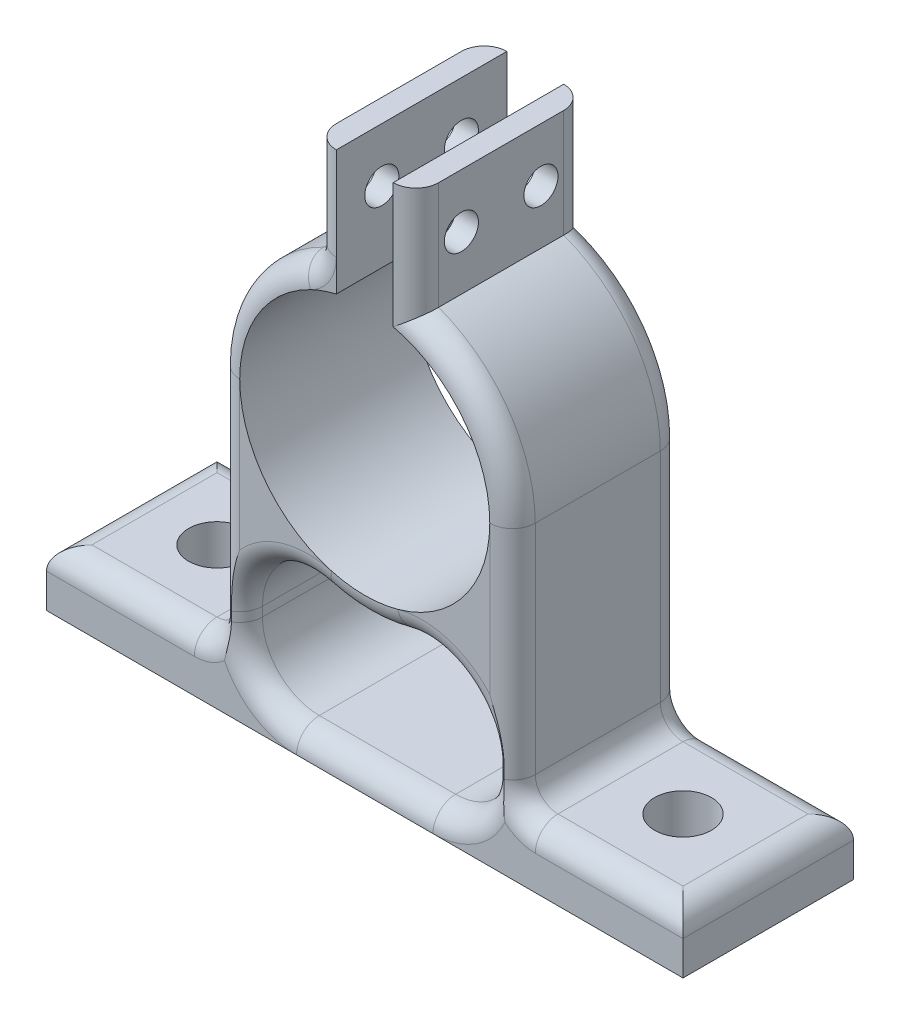
from build123d import *

# Parameters (mm, degrees)
EXTRUDE_1_DEPTH     = 15
SKETCH_2_W          = 15
SKETCH_2_H          = 15
SKETCH_2_R          = 2.5
EXTRUDE_2_DEPTH     = 5
FILLET_2_R          = 6
FILLET_1_R          = 5
FILLET_9_R          = 2
FILLET_10_R         = 2
FILLET_11_R         = 2
FILLET_12_R         = 2
SKETCH_2_3_R        = 2.5
CUT_EXTRUDE_1_DEPTH = 5
SKETCH_3_R          = 1.5
CUT_EXTRUDE_2_DEPTH = 45.329139442


# Read off the part's stored shape, not the designer's step: 보스-돌출1
with BuildPart() as part:
    # 보스-돌출1 outline → 보스-돌출1 (new body)
    with BuildSketch(Plane.XY):
        with BuildLine():
            Line((2.5, 21.696310918), (2.5, 10.712142643))
            ThreePointArc((2.5, 10.712142643), (0, -11), (-2.5, 10.712142643))
            Line((-2.5, 10.712142643), (-2.5, 21.696310918))
            Line((-2.5, 21.696310918), (-4.5, 21.696310918))
            Line((-4.5, 21.696310918), (-4.5, 12.196310918))
            ThreePointArc((-4.5, 12.196310918), (-10.665363983, 7.433035122), (-13, 1.824e-06))
            Line((-13, 1.824e-06), (-13, -26.150001824))
            Line((-13, -26.150001824), (13, -26.150001824))
            Line((13, -26.150001824), (13, -1.824e-06))
            ThreePointArc((13, -1.824e-06), (10.665365025, 7.433033626), (4.5, 12.196310918))
            Line((4.5, 12.196310918), (4.5, 21.696310918))
            Line((4.5, 21.696310918), (2.5, 21.696310918))
        make_face()
        with BuildLine():
            Line((11, -24.150001824), (-11, -24.150001824))
            Line((-11, -24.150001824), (-11, -6.92820323))
            ThreePointArc((-11, -6.92820323), (0, -13), (11, -6.92820323))
            Line((11, -6.92820323), (11, -24.150001824))
        make_face(mode=Mode.SUBTRACT)
    extrude(amount=EXTRUDE_1_DEPTH)

    # 스케치2 → 보스-돌출2 (add)
    # profile 1 of 4: a face of its own
    with BuildSketch(Plane.XZ.offset(26.150001824)):
        with Locations((-20.5, 7.5)):
            Rectangle(SKETCH_2_W, SKETCH_2_H)
        with Locations((-20.5, 7.5)):
            Circle(SKETCH_2_R, mode=Mode.SUBTRACT)
    # profile 2 of 4: a face of its own
    with BuildSketch(Plane.XZ.offset(26.150001824)):
        with Locations((20.5, 7.5)):
            Rectangle(SKETCH_2_W, SKETCH_2_H)
        with Locations((20.5, 7.5)):
            Circle(SKETCH_2_R, mode=Mode.SUBTRACT)
    # profile 3 of 4: a face of its own
    with BuildSketch(Plane.XZ.offset(26.150001824)):
        with Locations((20.5, 7.5)):
            Circle(SKETCH_2_R)
    # profile 4 of 4: a face of its own
    with BuildSketch(Plane.XZ.offset(26.150001824)):
        with Locations((-20.5, 7.5)):
            Circle(SKETCH_2_R)
    extrude(amount=-EXTRUDE_2_DEPTH)

    # 필렛2
    fillet_2_edges = [part.edges().sort_by_distance(p)[0] for p in [
        (11, -6.92820323, 7.5),
        (-11, -6.92820323, 7.5),
    ]]
    fillet(fillet_2_edges, radius=FILLET_2_R)

    # 필렛1
    fillet_1_edges = [part.edges().sort_by_distance(p)[0] for p in [
        (-11, -24.150001824, 7.5),
        (11, -24.150001824, 7.5),
    ]]
    fillet(fillet_1_edges, radius=FILLET_1_R)

    # 필렛9
    fillet_9_edges = [part.edges().sort_by_distance(p)[0] for p in [
        (-4.5, 12.196310918, 7.5),
    ]]
    fillet(fillet_9_edges, radius=FILLET_9_R)

    # 필렛10
    fillet_10_edges = [part.edges().sort_by_distance(p)[0] for p in [
        (-13, -21.150001824, 7.5),
    ]]
    fillet(fillet_10_edges, radius=FILLET_10_R)

    # 필렛11
    fillet_11_edges = [part.edges().sort_by_distance(p)[0] for p in [
        (13, -21.150001824, 7.5),
    ]]
    fillet(fillet_11_edges, radius=FILLET_11_R)

    # 필렛12
    # the kernel refuses this fillet: 2 mm, written as the material it takes off along each edge
    with BuildSketch(Plane(origin=(-6, -19.150001824, 15), x_dir=(-1, 0, 0), z_dir=(0, 1, 0))) as fillet_12_piece_1:
        with BuildLine():
            CenterArc((5 + FILLET_12_R, -FILLET_12_R), FILLET_12_R, 90, 90)
            Line((5 + FILLET_12_R, 0), (5 + FILLET_12_R, FILLET_12_R * 0.02))
            Line((5 + FILLET_12_R, FILLET_12_R * 0.02), (5 - FILLET_12_R * 0.02, FILLET_12_R * 0.02))
            Line((5 - FILLET_12_R * 0.02, FILLET_12_R * 0.02), (5 - FILLET_12_R * 0.02, -FILLET_12_R))
            Line((5 - FILLET_12_R * 0.02, -FILLET_12_R), (5, -FILLET_12_R))
        make_face()
    revolve(axis=Axis((-6, -19.150001824, 15), (0, 0, 1)), revolution_arc=90, mode=Mode.SUBTRACT)
    with BuildSketch(Plane(origin=(6, -19.150001824, 0), x_dir=(1, 0, 0), z_dir=(0, 1, 0))) as fillet_12_piece_2:
        with BuildLine():
            CenterArc((5 + FILLET_12_R, -FILLET_12_R), FILLET_12_R, 90, 90)
            Line((5, -FILLET_12_R), (5 - FILLET_12_R * 0.02, -FILLET_12_R))
            Line((5 - FILLET_12_R * 0.02, -FILLET_12_R), (5 - FILLET_12_R * 0.02, FILLET_12_R * 0.02))
            Line((5 - FILLET_12_R * 0.02, FILLET_12_R * 0.02), (5 + FILLET_12_R, FILLET_12_R * 0.02))
            Line((5 + FILLET_12_R, FILLET_12_R * 0.02), (5 + FILLET_12_R, 0))
        make_face()
    revolve(axis=Axis((6, -19.150001824, 0), (0, 0, -1)), revolution_arc=90, mode=Mode.SUBTRACT)
    with BuildSketch(Plane(origin=(-15, -21.150001824, 15), x_dir=(0, 0, -1), z_dir=(-1, 0, 0)), Plane(origin=(28, -21.150001824, 15), x_dir=(0, 0, -1), z_dir=(-1, 0, 0))) as fillet_12_piece_3:
        with BuildLine():
            CenterArc((FILLET_12_R, FILLET_12_R), FILLET_12_R, 180, 90)
            Line((0, FILLET_12_R), (-FILLET_12_R * 0.02, FILLET_12_R))
            Line((-FILLET_12_R * 0.02, FILLET_12_R), (-FILLET_12_R * 0.02, -FILLET_12_R * 0.02))
            Line((-FILLET_12_R * 0.02, -FILLET_12_R * 0.02), (FILLET_12_R, -FILLET_12_R * 0.02))
            Line((FILLET_12_R, -FILLET_12_R * 0.02), (FILLET_12_R, 0))
        make_face()
    extrude(amount=13, mode=Mode.SUBTRACT)
    with BuildSketch(Plane(origin=(-15, -19.150001824, 15), x_dir=(1, 0, 0), z_dir=(0, 1, 0))) as fillet_12_piece_4:
        with BuildLine():
            CenterArc((2 + FILLET_12_R, FILLET_12_R), FILLET_12_R, 180, 90)
            Line((2 + FILLET_12_R, 0), (2 + FILLET_12_R, -FILLET_12_R * 0.02))
            Line((2 + FILLET_12_R, -FILLET_12_R * 0.02), (2 - FILLET_12_R * 0.02, -FILLET_12_R * 0.02))
            Line((2 - FILLET_12_R * 0.02, -FILLET_12_R * 0.02), (2 - FILLET_12_R * 0.02, FILLET_12_R))
            Line((2 - FILLET_12_R * 0.02, FILLET_12_R), (2, FILLET_12_R))
        make_face()
    revolve(axis=Axis((-15, -19.150001824, 15), (0, 0, -1)), revolution_arc=90, mode=Mode.SUBTRACT)
    with BuildSketch(Plane(origin=(15, -21.150001824, 0), x_dir=(0, -1, 0), z_dir=(1, 0, 0)), Plane(origin=(-28, -21.150001824, 0), x_dir=(0, -1, 0), z_dir=(1, 0, 0))) as fillet_12_piece_5:
        with BuildLine():
            CenterArc((FILLET_12_R, -FILLET_12_R), FILLET_12_R, 90, 90)
            Line((0, -FILLET_12_R), (-FILLET_12_R * 0.02, -FILLET_12_R))
            Line((-FILLET_12_R * 0.02, -FILLET_12_R), (-FILLET_12_R * 0.02, FILLET_12_R * 0.02))
            Line((-FILLET_12_R * 0.02, FILLET_12_R * 0.02), (FILLET_12_R, FILLET_12_R * 0.02))
            Line((FILLET_12_R, FILLET_12_R * 0.02), (FILLET_12_R, 0))
        make_face()
    extrude(amount=13, mode=Mode.SUBTRACT)
    with BuildSketch(Plane(origin=(15, -19.150001824, 0), x_dir=(0, -1, 0), z_dir=(1, 0, 0))) as fillet_12_piece_6:
        with BuildLine():
            CenterArc((2 + FILLET_12_R, -FILLET_12_R), FILLET_12_R, 90, 90)
            Line((2, -FILLET_12_R), (2 - FILLET_12_R * 0.02, -FILLET_12_R))
            Line((2 - FILLET_12_R * 0.02, -FILLET_12_R), (2 - FILLET_12_R * 0.02, FILLET_12_R * 0.02))
            Line((2 - FILLET_12_R * 0.02, FILLET_12_R * 0.02), (2 + FILLET_12_R, FILLET_12_R * 0.02))
            Line((2 + FILLET_12_R, FILLET_12_R * 0.02), (2 + FILLET_12_R, 0))
        make_face()
    revolve(axis=Axis((15, -19.150001824, 0), (0, 0, -1)), revolution_arc=90, mode=Mode.SUBTRACT)
    with BuildSketch(Plane(origin=(28, -21.150001824, 0), x_dir=(-1, 0, 0), z_dir=(0, 0, 1))) as fillet_12_piece_7:
        with BuildLine():
            CenterArc((FILLET_12_R, FILLET_12_R), FILLET_12_R, 180, 90)
            Line((0, FILLET_12_R), (-FILLET_12_R * 0.02, FILLET_12_R))
            Line((-FILLET_12_R * 0.02, FILLET_12_R), (-FILLET_12_R * 0.02, -FILLET_12_R * 0.02))
            Line((-FILLET_12_R * 0.02, -FILLET_12_R * 0.02), (FILLET_12_R, -FILLET_12_R * 0.02))
            Line((FILLET_12_R, -FILLET_12_R * 0.02), (FILLET_12_R, 0))
        make_face()
    extrude(amount=15, mode=Mode.SUBTRACT)
    with BuildSketch(Plane(origin=(-28, -21.150001824, 15), x_dir=(0, -1, 0), z_dir=(0, 0, -1))) as fillet_12_piece_8:
        with BuildLine():
            CenterArc((FILLET_12_R, -FILLET_12_R), FILLET_12_R, 90, 90)
            Line((0, -FILLET_12_R), (-FILLET_12_R * 0.02, -FILLET_12_R))
            Line((-FILLET_12_R * 0.02, -FILLET_12_R), (-FILLET_12_R * 0.02, FILLET_12_R * 0.02))
            Line((-FILLET_12_R * 0.02, FILLET_12_R * 0.02), (FILLET_12_R, FILLET_12_R * 0.02))
            Line((FILLET_12_R, FILLET_12_R * 0.02), (FILLET_12_R, 0))
        make_face()
    extrude(amount=15, mode=Mode.SUBTRACT)
    with BuildSketch(Plane(origin=(6, -24.150001824, 0), x_dir=(0, -1, 0), z_dir=(-1, 0, 0)), Plane(origin=(6, -24.150001824, 15), x_dir=(0, 0, -1), z_dir=(-1, 0, 0))) as fillet_12_piece_9:
        with BuildLine():
            CenterArc((FILLET_12_R, FILLET_12_R), FILLET_12_R, 180, 90)
            Line((0, FILLET_12_R), (-FILLET_12_R * 0.02, FILLET_12_R))
            Line((-FILLET_12_R * 0.02, FILLET_12_R), (-FILLET_12_R * 0.02, -FILLET_12_R * 0.02))
            Line((-FILLET_12_R * 0.02, -FILLET_12_R * 0.02), (FILLET_12_R, -FILLET_12_R * 0.02))
            Line((FILLET_12_R, -FILLET_12_R * 0.02), (FILLET_12_R, 0))
        make_face()
    extrude(amount=12, mode=Mode.SUBTRACT)
    with BuildSketch(Plane(origin=(-6, -19.150001824, 0), x_dir=(-1, 0, 0), z_dir=(0, 1, 0))) as fillet_12_piece_10:
        with BuildLine():
            CenterArc((5 + FILLET_12_R, FILLET_12_R), FILLET_12_R, 180, 90)
            Line((5, FILLET_12_R), (5 - FILLET_12_R * 0.02, FILLET_12_R))
            Line((5 - FILLET_12_R * 0.02, FILLET_12_R), (5 - FILLET_12_R * 0.02, -FILLET_12_R * 0.02))
            Line((5 - FILLET_12_R * 0.02, -FILLET_12_R * 0.02), (5 + FILLET_12_R, -FILLET_12_R * 0.02))
            Line((5 + FILLET_12_R, -FILLET_12_R * 0.02), (5 + FILLET_12_R, 0))
        make_face()
    revolve(axis=Axis((-6, -19.150001824, 0), (0, 0, 1)), revolution_arc=90, mode=Mode.SUBTRACT)
    with BuildSketch(Plane(origin=(6, -19.150001824, 15), x_dir=(1, 0, 0), z_dir=(0, 1, 0))) as fillet_12_piece_11:
        with BuildLine():
            CenterArc((5 + FILLET_12_R, FILLET_12_R), FILLET_12_R, 180, 90)
            Line((5 + FILLET_12_R, 0), (5 + FILLET_12_R, -FILLET_12_R * 0.02))
            Line((5 + FILLET_12_R, -FILLET_12_R * 0.02), (5 - FILLET_12_R * 0.02, -FILLET_12_R * 0.02))
            Line((5 - FILLET_12_R * 0.02, -FILLET_12_R * 0.02), (5 - FILLET_12_R * 0.02, FILLET_12_R))
            Line((5 - FILLET_12_R * 0.02, FILLET_12_R), (5, FILLET_12_R))
        make_face()
    revolve(axis=Axis((6, -19.150001824, 15), (0, 0, -1)), revolution_arc=90, mode=Mode.SUBTRACT)
    with BuildSketch(Plane(origin=(-2e-09, 2e-09, 0), x_dir=(-0.4333333332698616, 0.9012337223369036, 0), z_dir=(0.9012337223369036, 0.4333333332698616, 0))) as fillet_12_piece_12:
        with BuildLine():
            CenterArc((12.999999998 - FILLET_12_R, FILLET_12_R), FILLET_12_R, 270, 90)
            Line((12.999999998, FILLET_12_R), (12.999999998 + FILLET_12_R * 0.02, FILLET_12_R))
            Line((12.999999998 + FILLET_12_R * 0.02, FILLET_12_R), (12.999999998 + FILLET_12_R * 0.02, -FILLET_12_R * 0.02))
            Line((12.999999998 + FILLET_12_R * 0.02, -FILLET_12_R * 0.02), (12.999999998 - FILLET_12_R, -FILLET_12_R * 0.02))
            Line((12.999999998 - FILLET_12_R, -FILLET_12_R * 0.02), (12.999999998 - FILLET_12_R, 0))
        make_face()
    revolve(axis=Axis((-2e-09, 2e-09, 0), (0, 0, 1)), revolution_arc=64.320703352, mode=Mode.SUBTRACT)
    with BuildSketch(Plane(origin=(-2e-09, 2e-09, 15), x_dir=(-0.4333333332698616, 0.9012337223369036, 0), z_dir=(0.9012337223369036, 0.4333333332698616, 0))) as fillet_12_piece_13:
        with BuildLine():
            CenterArc((12.999999998 - FILLET_12_R, -FILLET_12_R), FILLET_12_R, 0, 90)
            Line((12.999999998 - FILLET_12_R, 0), (12.999999998 - FILLET_12_R, FILLET_12_R * 0.02))
            Line((12.999999998 - FILLET_12_R, FILLET_12_R * 0.02), (12.999999998 + FILLET_12_R * 0.02, FILLET_12_R * 0.02))
            Line((12.999999998 + FILLET_12_R * 0.02, FILLET_12_R * 0.02), (12.999999998 + FILLET_12_R * 0.02, -FILLET_12_R))
            Line((12.999999998 + FILLET_12_R * 0.02, -FILLET_12_R), (12.999999998, -FILLET_12_R))
        make_face()
    revolve(axis=Axis((-2e-09, 2e-09, 15), (0, 0, 1)), revolution_arc=64.320703352, mode=Mode.SUBTRACT)
    with BuildSketch(Plane(origin=(-4.5, 21.696310918, 0), x_dir=(1, 0, 0), z_dir=(0, -1, 0)), Plane(origin=(-4.5, 21.696310918, 15), x_dir=(0, 0, -1), z_dir=(0, -1, 0))) as fillet_12_piece_14:
        with BuildLine():
            CenterArc((FILLET_12_R, FILLET_12_R), FILLET_12_R, 180, 90)
            Line((0, FILLET_12_R), (-FILLET_12_R * 0.02, FILLET_12_R))
            Line((-FILLET_12_R * 0.02, FILLET_12_R), (-FILLET_12_R * 0.02, -FILLET_12_R * 0.02))
            Line((-FILLET_12_R * 0.02, -FILLET_12_R * 0.02), (FILLET_12_R, -FILLET_12_R * 0.02))
            Line((FILLET_12_R, -FILLET_12_R * 0.02), (FILLET_12_R, 0))
        make_face()
    extrude(amount=8.177805083, mode=Mode.SUBTRACT)
    with BuildSketch(Plane(origin=(-6.5, 13.518505835, 0), x_dir=(1, 0, 0), z_dir=(0, 1, 0))) as fillet_12_piece_15:
        with BuildLine():
            CenterArc((2 + FILLET_12_R, -FILLET_12_R), FILLET_12_R, 90, 90)
            Line((2, -FILLET_12_R), (2 - FILLET_12_R * 0.02, -FILLET_12_R))
            Line((2 - FILLET_12_R * 0.02, -FILLET_12_R), (2 - FILLET_12_R * 0.02, FILLET_12_R * 0.02))
            Line((2 - FILLET_12_R * 0.02, FILLET_12_R * 0.02), (2 + FILLET_12_R, FILLET_12_R * 0.02))
            Line((2 + FILLET_12_R, FILLET_12_R * 0.02), (2 + FILLET_12_R, 0))
        make_face()
    revolve(axis=Axis((-6.5, 13.518505835, 0), (0, 0, -1)), revolution_arc=64.320711385, mode=Mode.SUBTRACT)
    with BuildSketch(Plane(origin=(-6.5, 13.518505835, 15), x_dir=(1, 0, 0), z_dir=(0, 1, 0))) as fillet_12_piece_16:
        with BuildLine():
            CenterArc((2 + FILLET_12_R, FILLET_12_R), FILLET_12_R, 180, 90)
            Line((2 + FILLET_12_R, 0), (2 + FILLET_12_R, -FILLET_12_R * 0.02))
            Line((2 + FILLET_12_R, -FILLET_12_R * 0.02), (2 - FILLET_12_R * 0.02, -FILLET_12_R * 0.02))
            Line((2 - FILLET_12_R * 0.02, -FILLET_12_R * 0.02), (2 - FILLET_12_R * 0.02, FILLET_12_R))
            Line((2 - FILLET_12_R * 0.02, FILLET_12_R), (2, FILLET_12_R))
        make_face()
    revolve(axis=Axis((-6.5, 13.518505835, 15), (0, 0, -1)), revolution_arc=64.320711385, mode=Mode.SUBTRACT)
    with BuildSketch(Plane(origin=(-13, 1.824e-06, 15), x_dir=(0, 0, -1), z_dir=(0, -1, 0)), Plane(origin=(-13, 1.824e-06, 0), x_dir=(1, 0, 0), z_dir=(0, -1, 0))) as fillet_12_piece_17:
        with BuildLine():
            CenterArc((FILLET_12_R, FILLET_12_R), FILLET_12_R, 180, 90)
            Line((0, FILLET_12_R), (-FILLET_12_R * 0.02, FILLET_12_R))
            Line((-FILLET_12_R * 0.02, FILLET_12_R), (-FILLET_12_R * 0.02, -FILLET_12_R * 0.02))
            Line((-FILLET_12_R * 0.02, -FILLET_12_R * 0.02), (FILLET_12_R, -FILLET_12_R * 0.02))
            Line((FILLET_12_R, -FILLET_12_R * 0.02), (FILLET_12_R, 0))
        make_face()
    extrude(amount=19.150003648, mode=Mode.SUBTRACT)
    with BuildSketch(Plane(origin=(-15, -19.150001824, 0), x_dir=(1, 0, 0), z_dir=(0, 1, 0))) as fillet_12_piece_18:
        with BuildLine():
            CenterArc((2 + FILLET_12_R, -FILLET_12_R), FILLET_12_R, 90, 90)
            Line((2, -FILLET_12_R), (2 - FILLET_12_R * 0.02, -FILLET_12_R))
            Line((2 - FILLET_12_R * 0.02, -FILLET_12_R), (2 - FILLET_12_R * 0.02, FILLET_12_R * 0.02))
            Line((2 - FILLET_12_R * 0.02, FILLET_12_R * 0.02), (2 + FILLET_12_R, FILLET_12_R * 0.02))
            Line((2 + FILLET_12_R, FILLET_12_R * 0.02), (2 + FILLET_12_R, 0))
        make_face()
    revolve(axis=Axis((-15, -19.150001824, 0), (0, 0, -1)), revolution_arc=90, mode=Mode.SUBTRACT)
    with BuildSketch(Plane(origin=(13, -19.150001824, 0), x_dir=(-1, 0, 0), z_dir=(0, 1, 0)), Plane(origin=(13, -19.150001824, 15), x_dir=(0, 0, -1), z_dir=(0, 1, 0))) as fillet_12_piece_19:
        with BuildLine():
            CenterArc((FILLET_12_R, FILLET_12_R), FILLET_12_R, 180, 90)
            Line((0, FILLET_12_R), (-FILLET_12_R * 0.02, FILLET_12_R))
            Line((-FILLET_12_R * 0.02, FILLET_12_R), (-FILLET_12_R * 0.02, -FILLET_12_R * 0.02))
            Line((-FILLET_12_R * 0.02, -FILLET_12_R * 0.02), (FILLET_12_R, -FILLET_12_R * 0.02))
            Line((FILLET_12_R, -FILLET_12_R * 0.02), (FILLET_12_R, 0))
        make_face()
    extrude(amount=19.15, mode=Mode.SUBTRACT)
    with BuildSketch(Plane(origin=(15, -19.150001824, 15), x_dir=(0, -1, 0), z_dir=(1, 0, 0))) as fillet_12_piece_20:
        with BuildLine():
            CenterArc((2 + FILLET_12_R, FILLET_12_R), FILLET_12_R, 180, 90)
            Line((2 + FILLET_12_R, 0), (2 + FILLET_12_R, -FILLET_12_R * 0.02))
            Line((2 + FILLET_12_R, -FILLET_12_R * 0.02), (2 - FILLET_12_R * 0.02, -FILLET_12_R * 0.02))
            Line((2 - FILLET_12_R * 0.02, -FILLET_12_R * 0.02), (2 - FILLET_12_R * 0.02, FILLET_12_R))
            Line((2 - FILLET_12_R * 0.02, FILLET_12_R), (2, FILLET_12_R))
        make_face()
    revolve(axis=Axis((15, -19.150001824, 15), (0, 0, -1)), revolution_arc=90, mode=Mode.SUBTRACT)
    with BuildSketch(Plane(origin=(4.5, 7.196310918, 0), x_dir=(-1, 0, 0), z_dir=(0, 1, 0))) as fillet_12_piece_21_section:
        with BuildLine():
            CenterArc((FILLET_12_R, FILLET_12_R), FILLET_12_R, 180, 90)
            Line((0, FILLET_12_R), (-FILLET_12_R * 0.02, FILLET_12_R))
            Line((-FILLET_12_R * 0.02, FILLET_12_R), (-FILLET_12_R * 0.02, -FILLET_12_R * 0.02))
            Line((-FILLET_12_R * 0.02, -FILLET_12_R * 0.02), (FILLET_12_R, -FILLET_12_R * 0.02))
            Line((FILLET_12_R, -FILLET_12_R * 0.02), (FILLET_12_R, 0))
        make_face()
    fillet_12_piece_21 = extrude(amount=14.5, mode=Mode.PRIVATE)
    fillet_12_piece_21 = fillet_12_piece_21 - Plane(origin=(-1e-09, 0, 0.456502174), x_dir=(0.9999999999999902, -1.4030200042681218e-07, 0), z_dir=(0, 0, -1)) * Cylinder(13.000000001, 37, mode=Mode.PRIVATE)
    add(fillet_12_piece_21, mode=Mode.SUBTRACT)
    with BuildSketch(Plane(origin=(-1e-09, 0, 0), x_dir=(0.9999999999999901, -1.4030200042681218e-07, 0), z_dir=(-1.4030200042681218e-07, -0.9999999999999901, 0))) as fillet_12_piece_22_section:
        with BuildLine():
            CenterArc((13.000000001 - FILLET_12_R, FILLET_12_R), FILLET_12_R, 270, 90)
            Line((13.000000001, FILLET_12_R), (13.000000001 + FILLET_12_R * 0.02, FILLET_12_R))
            Line((13.000000001 + FILLET_12_R * 0.02, FILLET_12_R), (13.000000001 + FILLET_12_R * 0.02, -FILLET_12_R * 0.02))
            Line((13.000000001 + FILLET_12_R * 0.02, -FILLET_12_R * 0.02), (13.000000001 - FILLET_12_R, -FILLET_12_R * 0.02))
            Line((13.000000001 - FILLET_12_R, -FILLET_12_R * 0.02), (13.000000001 - FILLET_12_R, 0))
        make_face()
    fillet_12_piece_22 = revolve(axis=Axis((-1e-09, 0, 0), (0, 0, 1)), revolution_arc=91.789915589, mode=Mode.PRIVATE)
    fillet_12_piece_22 = split(fillet_12_piece_22, bisect_by=Plane(origin=(4.5, 7.108158111, 0.56819085), z_dir=(1, 0, 0)), keep=Keep.TOP, mode=Mode.PRIVATE)
    add(fillet_12_piece_22, mode=Mode.SUBTRACT)
    with BuildSketch(Plane(origin=(-1e-09, 0, 15), x_dir=(0.9999999999999901, -1.4030200042681218e-07, 0), z_dir=(-1.4030200042681218e-07, -0.9999999999999901, 0))) as fillet_12_piece_23_section:
        with BuildLine():
            CenterArc((13.000000001 - FILLET_12_R, -FILLET_12_R), FILLET_12_R, 0, 90)
            Line((13.000000001 - FILLET_12_R, 0), (13.000000001 - FILLET_12_R, FILLET_12_R * 0.02))
            Line((13.000000001 - FILLET_12_R, FILLET_12_R * 0.02), (13.000000001 + FILLET_12_R * 0.02, FILLET_12_R * 0.02))
            Line((13.000000001 + FILLET_12_R * 0.02, FILLET_12_R * 0.02), (13.000000001 + FILLET_12_R * 0.02, -FILLET_12_R))
            Line((13.000000001 + FILLET_12_R * 0.02, -FILLET_12_R), (13.000000001, -FILLET_12_R))
        make_face()
    fillet_12_piece_23 = revolve(axis=Axis((-1e-09, 0, 15), (0, 0, 1)), revolution_arc=91.789915589, mode=Mode.PRIVATE)
    fillet_12_piece_23 = split(fillet_12_piece_23, bisect_by=Plane(origin=(4.5, 7.108158111, 14.43180915), z_dir=(1, 0, 0)), keep=Keep.TOP, mode=Mode.PRIVATE)
    add(fillet_12_piece_23, mode=Mode.SUBTRACT)
    with BuildSketch(Plane(origin=(4.5, 7.196310918, 15), x_dir=(0, 0, -1), z_dir=(0, 1, 0))) as fillet_12_piece_24_section:
        with BuildLine():
            CenterArc((FILLET_12_R, FILLET_12_R), FILLET_12_R, 180, 90)
            Line((0, FILLET_12_R), (-FILLET_12_R * 0.02, FILLET_12_R))
            Line((-FILLET_12_R * 0.02, FILLET_12_R), (-FILLET_12_R * 0.02, -FILLET_12_R * 0.02))
            Line((-FILLET_12_R * 0.02, -FILLET_12_R * 0.02), (FILLET_12_R, -FILLET_12_R * 0.02))
            Line((FILLET_12_R, -FILLET_12_R * 0.02), (FILLET_12_R, 0))
        make_face()
    fillet_12_piece_24 = extrude(amount=14.5, mode=Mode.PRIVATE)
    fillet_12_piece_24 = fillet_12_piece_24 - Plane(origin=(-1e-09, 0, 14.543497987), x_dir=(0.9999999999999902, -1.4030200042681218e-07, 0), z_dir=(0, 0, -1)) * Cylinder(13.000000001, 37, mode=Mode.PRIVATE)
    add(fillet_12_piece_24, mode=Mode.SUBTRACT)
    with BuildSketch(Plane(origin=(0, 0, 0), x_dir=(-0.26315789474119605, -0.9647527778842524, 0), z_dir=(-0.9647527778842524, 0.26315789474119605, 0))) as fillet_12_piece_25:
        with BuildLine():
            CenterArc((13 - FILLET_12_R, FILLET_12_R), FILLET_12_R, 270, 90)
            Line((13, FILLET_12_R), (13 + FILLET_12_R * 0.02, FILLET_12_R))
            Line((13 + FILLET_12_R * 0.02, FILLET_12_R), (13 + FILLET_12_R * 0.02, -FILLET_12_R * 0.02))
            Line((13 + FILLET_12_R * 0.02, -FILLET_12_R * 0.02), (13 - FILLET_12_R, -FILLET_12_R * 0.02))
            Line((13 - FILLET_12_R, -FILLET_12_R * 0.02), (13 - FILLET_12_R, 0))
        make_face()
    revolve(axis=Axis((0, 0, 0), (0, 0, 1)), revolution_arc=30.515046581, mode=Mode.SUBTRACT)
    with BuildSketch(Plane(origin=(0, 0, 15), x_dir=(-0.26315789474119605, -0.9647527778842524, 0), z_dir=(-0.9647527778842524, 0.26315789474119605, 0))) as fillet_12_piece_26:
        with BuildLine():
            CenterArc((13 - FILLET_12_R, -FILLET_12_R), FILLET_12_R, 0, 90)
            Line((13 - FILLET_12_R, 0), (13 - FILLET_12_R, FILLET_12_R * 0.02))
            Line((13 - FILLET_12_R, FILLET_12_R * 0.02), (13 + FILLET_12_R * 0.02, FILLET_12_R * 0.02))
            Line((13 + FILLET_12_R * 0.02, FILLET_12_R * 0.02), (13 + FILLET_12_R * 0.02, -FILLET_12_R))
            Line((13 + FILLET_12_R * 0.02, -FILLET_12_R), (13, -FILLET_12_R))
        make_face()
    revolve(axis=Axis((0, 0, 15), (0, 0, 1)), revolution_arc=30.515046581, mode=Mode.SUBTRACT)
    with BuildSketch(Plane(origin=(-11, -19.150001824, 0), x_dir=(-1, 0, 0), z_dir=(0, 1, 0)), Plane(origin=(-11, -19.150001824, 15), x_dir=(0, 0, -1), z_dir=(0, 1, 0)), Plane(origin=(11, -18.33030278, 0), x_dir=(1, 0, 0), z_dir=(0, -1, 0)), Plane(origin=(11, -18.33030278, 15), x_dir=(0, 0, -1), z_dir=(0, -1, 0))) as fillet_12_piece_27:
        with BuildLine():
            CenterArc((FILLET_12_R, FILLET_12_R), FILLET_12_R, 180, 90)
            Line((0, FILLET_12_R), (-FILLET_12_R * 0.02, FILLET_12_R))
            Line((-FILLET_12_R * 0.02, FILLET_12_R), (-FILLET_12_R * 0.02, -FILLET_12_R * 0.02))
            Line((-FILLET_12_R * 0.02, -FILLET_12_R * 0.02), (FILLET_12_R, -FILLET_12_R * 0.02))
            Line((FILLET_12_R, -FILLET_12_R * 0.02), (FILLET_12_R, 0))
        make_face()
    extrude(amount=0.819699044, mode=Mode.SUBTRACT)
    with BuildSketch(Plane(origin=(-5, -18.33030278, 0), x_dir=(0.2631578947411966, 0.9647527778842523, 0), z_dir=(0.9647527778842523, -0.2631578947411966, 0))) as fillet_12_piece_28:
        with BuildLine():
            CenterArc((6 + FILLET_12_R, FILLET_12_R), FILLET_12_R, 180, 90)
            Line((6, FILLET_12_R), (6 - FILLET_12_R * 0.02, FILLET_12_R))
            Line((6 - FILLET_12_R * 0.02, FILLET_12_R), (6 - FILLET_12_R * 0.02, -FILLET_12_R * 0.02))
            Line((6 - FILLET_12_R * 0.02, -FILLET_12_R * 0.02), (6 + FILLET_12_R, -FILLET_12_R * 0.02))
            Line((6 + FILLET_12_R, -FILLET_12_R * 0.02), (6 + FILLET_12_R, 0))
        make_face()
    revolve(axis=Axis((-5, -18.33030278, 0), (0, 0, 1)), revolution_arc=105.257523291, mode=Mode.SUBTRACT)
    with BuildSketch(Plane(origin=(-5, -18.33030278, 15), x_dir=(0.2631578947411966, 0.9647527778842523, 0), z_dir=(0.9647527778842523, -0.2631578947411966, 0))) as fillet_12_piece_29:
        with BuildLine():
            CenterArc((6 + FILLET_12_R, -FILLET_12_R), FILLET_12_R, 90, 90)
            Line((6 + FILLET_12_R, 0), (6 + FILLET_12_R, FILLET_12_R * 0.02))
            Line((6 + FILLET_12_R, FILLET_12_R * 0.02), (6 - FILLET_12_R * 0.02, FILLET_12_R * 0.02))
            Line((6 - FILLET_12_R * 0.02, FILLET_12_R * 0.02), (6 - FILLET_12_R * 0.02, -FILLET_12_R))
            Line((6 - FILLET_12_R * 0.02, -FILLET_12_R), (6, -FILLET_12_R))
        make_face()
    revolve(axis=Axis((-5, -18.33030278, 15), (0, 0, 1)), revolution_arc=105.257523291, mode=Mode.SUBTRACT)
    with BuildSketch(Plane(origin=(5, -18.33030278, 0), x_dir=(-0.2631578947411963, 0.9647527778842524, 0), z_dir=(-0.9647527778842524, -0.2631578947411963, 0))) as fillet_12_piece_30:
        with BuildLine():
            CenterArc((6 + FILLET_12_R, -FILLET_12_R), FILLET_12_R, 90, 90)
            Line((6, -FILLET_12_R), (6 - FILLET_12_R * 0.02, -FILLET_12_R))
            Line((6 - FILLET_12_R * 0.02, -FILLET_12_R), (6 - FILLET_12_R * 0.02, FILLET_12_R * 0.02))
            Line((6 - FILLET_12_R * 0.02, FILLET_12_R * 0.02), (6 + FILLET_12_R, FILLET_12_R * 0.02))
            Line((6 + FILLET_12_R, FILLET_12_R * 0.02), (6 + FILLET_12_R, 0))
        make_face()
    revolve(axis=Axis((5, -18.33030278, 0), (0, 0, -1)), revolution_arc=105.257523291, mode=Mode.SUBTRACT)
    with BuildSketch(Plane(origin=(5, -18.33030278, 15), x_dir=(-0.2631578947411963, 0.9647527778842524, 0), z_dir=(-0.9647527778842524, -0.2631578947411963, 0))) as fillet_12_piece_31:
        with BuildLine():
            CenterArc((6 + FILLET_12_R, FILLET_12_R), FILLET_12_R, 180, 90)
            Line((6 + FILLET_12_R, 0), (6 + FILLET_12_R, -FILLET_12_R * 0.02))
            Line((6 + FILLET_12_R, -FILLET_12_R * 0.02), (6 - FILLET_12_R * 0.02, -FILLET_12_R * 0.02))
            Line((6 - FILLET_12_R * 0.02, -FILLET_12_R * 0.02), (6 - FILLET_12_R * 0.02, FILLET_12_R))
            Line((6 - FILLET_12_R * 0.02, FILLET_12_R), (6, FILLET_12_R))
        make_face()
    revolve(axis=Axis((5, -18.33030278, 15), (0, 0, -1)), revolution_arc=105.257523291, mode=Mode.SUBTRACT)
    with BuildSketch(Plane(origin=(-28, -21.150001824, 20), x_dir=(0, -1, 0), z_dir=(0, 0, -1))) as fillet_12_piece_32a_section:
        with BuildLine():
            CenterArc((FILLET_12_R, -FILLET_12_R), FILLET_12_R, 90, 90)
            Line((0, -FILLET_12_R), (-FILLET_12_R * 0.02, -FILLET_12_R))
            Line((-FILLET_12_R * 0.02, -FILLET_12_R), (-FILLET_12_R * 0.02, FILLET_12_R * 0.02))
            Line((-FILLET_12_R * 0.02, FILLET_12_R * 0.02), (FILLET_12_R, FILLET_12_R * 0.02))
            Line((FILLET_12_R, FILLET_12_R * 0.02), (FILLET_12_R, 0))
        make_face()
    fillet_12_piece_32a = extrude(amount=20, mode=Mode.PRIVATE)
    fillet_12_piece_32a = split(fillet_12_piece_32a, bisect_by=Plane(origin=(-27.547209771, -21.602792052, 15), z_dir=(0, 0, 1)), keep=Keep.TOP, mode=Mode.PRIVATE)
    with BuildSketch(Plane(origin=(-15, -21.150001824, 15), x_dir=(0, 0, -1), z_dir=(-1, 0, 0))) as fillet_12_piece_32b_section:
        with BuildLine():
            CenterArc((FILLET_12_R, FILLET_12_R), FILLET_12_R, 180, 90)
            Line((0, FILLET_12_R), (-FILLET_12_R * 0.02, FILLET_12_R))
            Line((-FILLET_12_R * 0.02, FILLET_12_R), (-FILLET_12_R * 0.02, -FILLET_12_R * 0.02))
            Line((-FILLET_12_R * 0.02, -FILLET_12_R * 0.02), (FILLET_12_R, -FILLET_12_R * 0.02))
            Line((FILLET_12_R, -FILLET_12_R * 0.02), (FILLET_12_R, 0))
        make_face()
    fillet_12_piece_32b = extrude(amount=18, mode=Mode.PRIVATE)
    fillet_12_piece_32b = split(fillet_12_piece_32b, bisect_by=Plane(origin=(-28, -21.602792052, 14.547209771), z_dir=(-1, 0, 0)), keep=Keep.TOP, mode=Mode.PRIVATE)
    fillet_12_piece_32 = fillet_12_piece_32a & fillet_12_piece_32b
    add(fillet_12_piece_32, mode=Mode.SUBTRACT)
    with BuildSketch(Plane(origin=(15, -21.150001824, 0), x_dir=(0, -1, 0), z_dir=(1, 0, 0))) as fillet_12_piece_33a_section:
        with BuildLine():
            CenterArc((FILLET_12_R, -FILLET_12_R), FILLET_12_R, 90, 90)
            Line((0, -FILLET_12_R), (-FILLET_12_R * 0.02, -FILLET_12_R))
            Line((-FILLET_12_R * 0.02, -FILLET_12_R), (-FILLET_12_R * 0.02, FILLET_12_R * 0.02))
            Line((-FILLET_12_R * 0.02, FILLET_12_R * 0.02), (FILLET_12_R, FILLET_12_R * 0.02))
            Line((FILLET_12_R, FILLET_12_R * 0.02), (FILLET_12_R, 0))
        make_face()
    fillet_12_piece_33a = extrude(amount=18, mode=Mode.PRIVATE)
    fillet_12_piece_33a = split(fillet_12_piece_33a, bisect_by=Plane(origin=(28, -21.602792052, 0.452790229), z_dir=(1, 0, 0)), keep=Keep.TOP, mode=Mode.PRIVATE)
    with BuildSketch(Plane(origin=(28, -21.150001824, -5), x_dir=(-1, 0, 0), z_dir=(0, 0, 1))) as fillet_12_piece_33b_section:
        with BuildLine():
            CenterArc((FILLET_12_R, FILLET_12_R), FILLET_12_R, 180, 90)
            Line((0, FILLET_12_R), (-FILLET_12_R * 0.02, FILLET_12_R))
            Line((-FILLET_12_R * 0.02, FILLET_12_R), (-FILLET_12_R * 0.02, -FILLET_12_R * 0.02))
            Line((-FILLET_12_R * 0.02, -FILLET_12_R * 0.02), (FILLET_12_R, -FILLET_12_R * 0.02))
            Line((FILLET_12_R, -FILLET_12_R * 0.02), (FILLET_12_R, 0))
        make_face()
    fillet_12_piece_33b = extrude(amount=20, mode=Mode.PRIVATE)
    fillet_12_piece_33b = split(fillet_12_piece_33b, bisect_by=Plane(origin=(27.547209771, -21.602792052, 0), z_dir=(0, 0, -1)), keep=Keep.TOP, mode=Mode.PRIVATE)
    fillet_12_piece_33 = fillet_12_piece_33a & fillet_12_piece_33b
    add(fillet_12_piece_33, mode=Mode.SUBTRACT)
    with BuildSketch(Plane(origin=(28, -21.150001824, 0), x_dir=(-1, 0, 0), z_dir=(0, 0, 1))) as fillet_12_piece_34a_section:
        with BuildLine():
            CenterArc((FILLET_12_R, FILLET_12_R), FILLET_12_R, 180, 90)
            Line((0, FILLET_12_R), (-FILLET_12_R * 0.02, FILLET_12_R))
            Line((-FILLET_12_R * 0.02, FILLET_12_R), (-FILLET_12_R * 0.02, -FILLET_12_R * 0.02))
            Line((-FILLET_12_R * 0.02, -FILLET_12_R * 0.02), (FILLET_12_R, -FILLET_12_R * 0.02))
            Line((FILLET_12_R, -FILLET_12_R * 0.02), (FILLET_12_R, 0))
        make_face()
    fillet_12_piece_34a = extrude(amount=20, mode=Mode.PRIVATE)
    fillet_12_piece_34a = split(fillet_12_piece_34a, bisect_by=Plane(origin=(27.547209771, -21.602792052, 15), z_dir=(0, 0, 1)), keep=Keep.TOP, mode=Mode.PRIVATE)
    with BuildSketch(Plane(origin=(33, -21.150001824, 15), x_dir=(0, 0, -1), z_dir=(-1, 0, 0))) as fillet_12_piece_34b_section:
        with BuildLine():
            CenterArc((FILLET_12_R, FILLET_12_R), FILLET_12_R, 180, 90)
            Line((0, FILLET_12_R), (-FILLET_12_R * 0.02, FILLET_12_R))
            Line((-FILLET_12_R * 0.02, FILLET_12_R), (-FILLET_12_R * 0.02, -FILLET_12_R * 0.02))
            Line((-FILLET_12_R * 0.02, -FILLET_12_R * 0.02), (FILLET_12_R, -FILLET_12_R * 0.02))
            Line((FILLET_12_R, -FILLET_12_R * 0.02), (FILLET_12_R, 0))
        make_face()
    fillet_12_piece_34b = extrude(amount=18, mode=Mode.PRIVATE)
    fillet_12_piece_34b = split(fillet_12_piece_34b, bisect_by=Plane(origin=(28, -21.602792052, 14.547209771), z_dir=(1, 0, 0)), keep=Keep.TOP, mode=Mode.PRIVATE)
    fillet_12_piece_34 = fillet_12_piece_34a & fillet_12_piece_34b
    add(fillet_12_piece_34, mode=Mode.SUBTRACT)
    with BuildSketch(Plane(origin=(-33, -21.150001824, 0), x_dir=(0, -1, 0), z_dir=(1, 0, 0))) as fillet_12_piece_35a_section:
        with BuildLine():
            CenterArc((FILLET_12_R, -FILLET_12_R), FILLET_12_R, 90, 90)
            Line((0, -FILLET_12_R), (-FILLET_12_R * 0.02, -FILLET_12_R))
            Line((-FILLET_12_R * 0.02, -FILLET_12_R), (-FILLET_12_R * 0.02, FILLET_12_R * 0.02))
            Line((-FILLET_12_R * 0.02, FILLET_12_R * 0.02), (FILLET_12_R, FILLET_12_R * 0.02))
            Line((FILLET_12_R, FILLET_12_R * 0.02), (FILLET_12_R, 0))
        make_face()
    fillet_12_piece_35a = extrude(amount=18, mode=Mode.PRIVATE)
    fillet_12_piece_35a = split(fillet_12_piece_35a, bisect_by=Plane(origin=(-28, -21.602792052, 0.452790229), z_dir=(-1, 0, 0)), keep=Keep.TOP, mode=Mode.PRIVATE)
    with BuildSketch(Plane(origin=(-28, -21.150001824, 15), x_dir=(0, -1, 0), z_dir=(0, 0, -1))) as fillet_12_piece_35b_section:
        with BuildLine():
            CenterArc((FILLET_12_R, -FILLET_12_R), FILLET_12_R, 90, 90)
            Line((0, -FILLET_12_R), (-FILLET_12_R * 0.02, -FILLET_12_R))
            Line((-FILLET_12_R * 0.02, -FILLET_12_R), (-FILLET_12_R * 0.02, FILLET_12_R * 0.02))
            Line((-FILLET_12_R * 0.02, FILLET_12_R * 0.02), (FILLET_12_R, FILLET_12_R * 0.02))
            Line((FILLET_12_R, FILLET_12_R * 0.02), (FILLET_12_R, 0))
        make_face()
    fillet_12_piece_35b = extrude(amount=20, mode=Mode.PRIVATE)
    fillet_12_piece_35b = split(fillet_12_piece_35b, bisect_by=Plane(origin=(-27.547209771, -21.602792052, 0), z_dir=(0, 0, -1)), keep=Keep.TOP, mode=Mode.PRIVATE)
    fillet_12_piece_35 = fillet_12_piece_35a & fillet_12_piece_35b
    add(fillet_12_piece_35, mode=Mode.SUBTRACT)
    with BuildSketch(Plane(origin=(-1e-09, 0, 0), x_dir=(0.9999999999999901, -1.4030200042681218e-07, 0), z_dir=(-1.4030200042681218e-07, -0.9999999999999901, 0))) as fillet_12_piece_36a_section:
        with BuildLine():
            CenterArc((13.000000001 - FILLET_12_R, FILLET_12_R), FILLET_12_R, 270, 90)
            Line((13.000000001, FILLET_12_R), (13.000000001 + FILLET_12_R * 0.02, FILLET_12_R))
            Line((13.000000001 + FILLET_12_R * 0.02, FILLET_12_R), (13.000000001 + FILLET_12_R * 0.02, -FILLET_12_R * 0.02))
            Line((13.000000001 + FILLET_12_R * 0.02, -FILLET_12_R * 0.02), (13.000000001 - FILLET_12_R, -FILLET_12_R * 0.02))
            Line((13.000000001 - FILLET_12_R, -FILLET_12_R * 0.02), (13.000000001 - FILLET_12_R, 0))
        make_face()
    fillet_12_piece_36a = revolve(axis=Axis((-1e-09, 0, 0), (0, 0, 1)), revolution_arc=91.789915589, mode=Mode.PRIVATE)
    fillet_12_piece_36a = split(fillet_12_piece_36a, bisect_by=Plane(origin=(4.5, 12.289550143, 0.453077759), z_dir=(-1, 0, 0)), keep=Keep.TOP, mode=Mode.PRIVATE)
    with BuildSketch(Plane(origin=(4.5, 7.196310918, 0), x_dir=(-1, 0, 0), z_dir=(0, 1, 0))) as fillet_12_piece_36b_section:
        with BuildLine():
            CenterArc((FILLET_12_R, FILLET_12_R), FILLET_12_R, 180, 90)
            Line((0, FILLET_12_R), (-FILLET_12_R * 0.02, FILLET_12_R))
            Line((-FILLET_12_R * 0.02, FILLET_12_R), (-FILLET_12_R * 0.02, -FILLET_12_R * 0.02))
            Line((-FILLET_12_R * 0.02, -FILLET_12_R * 0.02), (FILLET_12_R, -FILLET_12_R * 0.02))
            Line((FILLET_12_R, -FILLET_12_R * 0.02), (FILLET_12_R, 0))
        make_face()
    fillet_12_piece_36b = extrude(amount=14.5, mode=Mode.PRIVATE)
    fillet_12_piece_36b = fillet_12_piece_36b & Plane(origin=(-1e-09, 0, 0.446051182), x_dir=(0.9999999999999902, -1.4030200042681218e-07, 0), z_dir=(0, 0, -1)) * Cylinder(13.000000001, 37, mode=Mode.PRIVATE)
    fillet_12_piece_36 = fillet_12_piece_36a & fillet_12_piece_36b
    add(fillet_12_piece_36, mode=Mode.SUBTRACT)
    with BuildSketch(Plane(origin=(-1e-09, 0, 15), x_dir=(0.9999999999999901, -1.4030200042681218e-07, 0), z_dir=(-1.4030200042681218e-07, -0.9999999999999901, 0))) as fillet_12_piece_37a_section:
        with BuildLine():
            CenterArc((13.000000001 - FILLET_12_R, -FILLET_12_R), FILLET_12_R, 0, 90)
            Line((13.000000001 - FILLET_12_R, 0), (13.000000001 - FILLET_12_R, FILLET_12_R * 0.02))
            Line((13.000000001 - FILLET_12_R, FILLET_12_R * 0.02), (13.000000001 + FILLET_12_R * 0.02, FILLET_12_R * 0.02))
            Line((13.000000001 + FILLET_12_R * 0.02, FILLET_12_R * 0.02), (13.000000001 + FILLET_12_R * 0.02, -FILLET_12_R))
            Line((13.000000001 + FILLET_12_R * 0.02, -FILLET_12_R), (13.000000001, -FILLET_12_R))
        make_face()
    fillet_12_piece_37a = revolve(axis=Axis((-1e-09, 0, 15), (0, 0, 1)), revolution_arc=91.789915589, mode=Mode.PRIVATE)
    fillet_12_piece_37a = split(fillet_12_piece_37a, bisect_by=Plane(origin=(4.5, 12.289550131, 14.546922238), z_dir=(-1, 0, 0)), keep=Keep.TOP, mode=Mode.PRIVATE)
    with BuildSketch(Plane(origin=(4.5, 7.196310918, 15), x_dir=(0, 0, -1), z_dir=(0, 1, 0))) as fillet_12_piece_37b_section:
        with BuildLine():
            CenterArc((FILLET_12_R, FILLET_12_R), FILLET_12_R, 180, 90)
            Line((0, FILLET_12_R), (-FILLET_12_R * 0.02, FILLET_12_R))
            Line((-FILLET_12_R * 0.02, FILLET_12_R), (-FILLET_12_R * 0.02, -FILLET_12_R * 0.02))
            Line((-FILLET_12_R * 0.02, -FILLET_12_R * 0.02), (FILLET_12_R, -FILLET_12_R * 0.02))
            Line((FILLET_12_R, -FILLET_12_R * 0.02), (FILLET_12_R, 0))
        make_face()
    fillet_12_piece_37b = extrude(amount=14.5, mode=Mode.PRIVATE)
    fillet_12_piece_37b = fillet_12_piece_37b & Plane(origin=(-1e-09, 0, 14.553948517), x_dir=(0.9999999999999902, -1.4030200042681218e-07, 0), z_dir=(0, 0, -1)) * Cylinder(13.000000001, 37, mode=Mode.PRIVATE)
    fillet_12_piece_37 = fillet_12_piece_37a & fillet_12_piece_37b
    add(fillet_12_piece_37, mode=Mode.SUBTRACT)

    # 스케치2<3> → 컷-돌출1 (cut)
    with BuildSketch(Plane.XZ.offset(26.150001824)):
        with Locations((-20.5, 7.5)):
            Circle(SKETCH_2_3_R)
        with Locations(Location((20.5, 7.5, 0), (0, 0, 180))):
            Circle(SKETCH_2_3_R)
    extrude(amount=-CUT_EXTRUDE_1_DEPTH, mode=Mode.SUBTRACT)

    # 스케치3 → 컷-돌출2 (cut, through all)
    with BuildSketch(Plane(origin=(4.5, 0, 0), x_dir=(0, 0, -1), z_dir=(1, 0, 0))):
        with Locations((-11, 16.946310918)):
            Circle(SKETCH_3_R)
        with Locations((-4, 16.946310918)):
            Circle(SKETCH_3_R)
    extrude(amount=-CUT_EXTRUDE_2_DEPTH, mode=Mode.SUBTRACT)


solid = part.part
